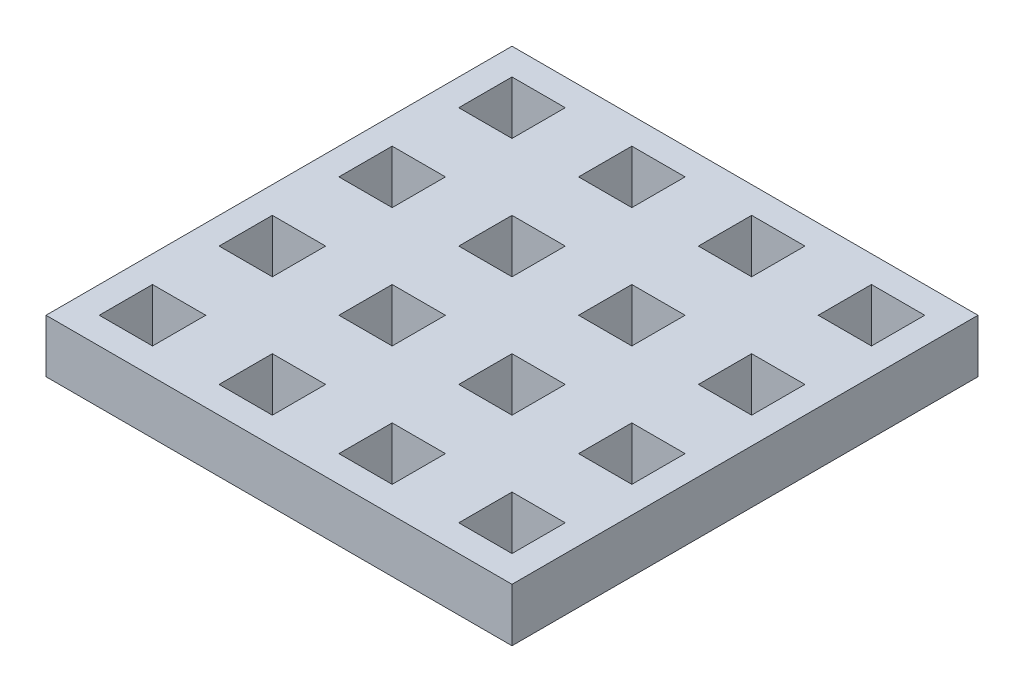
from build123d import *

# Parameters (mm, degrees)
SKETCH1_W           = 88.9
SKETCH1_H           = 88.9
SKETCH1_W_2         = 10.16
SKETCH1_H_2         = 10.16
BOSS_EXTRUDE1_DEPTH = 10.16


with BuildPart() as part:
    # Sketch1 → Boss-Extrude1 (new body)
    with BuildSketch(Plane(origin=(0, 0, 0), x_dir=(1, 0, 0), z_dir=(0, 1, 0))):
        with Locations((44.45, -44.45)):
            Rectangle(SKETCH1_W, SKETCH1_H)
        with Locations((33.02, -10.16)):
            Rectangle(SKETCH1_W_2, SKETCH1_H_2, mode=Mode.SUBTRACT)
        with Locations((10.16, -10.16)):
            Rectangle(SKETCH1_W_2, SKETCH1_H_2, mode=Mode.SUBTRACT)
        with Locations((55.88, -10.16)):
            Rectangle(SKETCH1_W_2, SKETCH1_H_2, mode=Mode.SUBTRACT)
        with Locations((78.74, -10.16)):
            Rectangle(SKETCH1_W_2, SKETCH1_H_2, mode=Mode.SUBTRACT)
        with Locations((33.02, -33.02)):
            Rectangle(SKETCH1_W_2, SKETCH1_H_2, mode=Mode.SUBTRACT)
        with Locations((55.88, -33.02)):
            Rectangle(SKETCH1_W_2, SKETCH1_H_2, mode=Mode.SUBTRACT)
        with Locations((78.74, -33.02)):
            Rectangle(SKETCH1_W_2, SKETCH1_H_2, mode=Mode.SUBTRACT)
        with Locations((33.02, -55.88)):
            Rectangle(SKETCH1_W_2, SKETCH1_H_2, mode=Mode.SUBTRACT)
        with Locations((55.88, -55.88)):
            Rectangle(SKETCH1_W_2, SKETCH1_H_2, mode=Mode.SUBTRACT)
        with Locations((78.74, -55.88)):
            Rectangle(SKETCH1_W_2, SKETCH1_H_2, mode=Mode.SUBTRACT)
        with Locations((33.02, -78.74)):
            Rectangle(SKETCH1_W_2, SKETCH1_H_2, mode=Mode.SUBTRACT)
        with Locations((55.88, -78.74)):
            Rectangle(SKETCH1_W_2, SKETCH1_H_2, mode=Mode.SUBTRACT)
        with Locations((78.74, -78.74)):
            Rectangle(SKETCH1_W_2, SKETCH1_H_2, mode=Mode.SUBTRACT)
        with Locations((10.16, -33.02)):
            Rectangle(SKETCH1_W_2, SKETCH1_H_2, mode=Mode.SUBTRACT)
        with Locations((10.16, -55.88)):
            Rectangle(SKETCH1_W_2, SKETCH1_H_2, mode=Mode.SUBTRACT)
        with Locations((10.16, -78.74)):
            Rectangle(SKETCH1_W_2, SKETCH1_H_2, mode=Mode.SUBTRACT)
    extrude(amount=BOSS_EXTRUDE1_DEPTH)


solid = part.part
